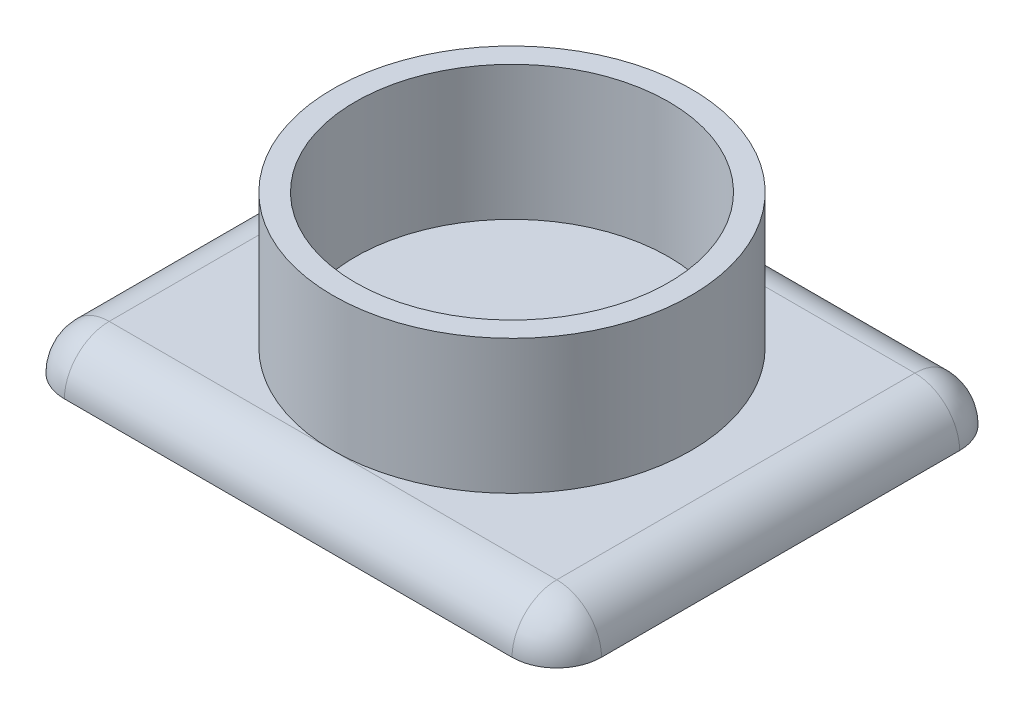
from build123d import *

# Parameters (mm, degrees)
SKETCH1_R           = 40
SKETCH1_R_2         = 35
BOSS_EXTRUDE1_DEPTH = 30
SKETCH2_W           = 120
SKETCH2_H           = 100
BOSS_EXTRUDE2_DEPTH = 10
FILLET4_R           = 10
FILLET5_R           = 10


with BuildPart() as part:
    # Sketch1 → Boss-Extrude1 (new body)
    with BuildSketch(Plane(origin=(0, 0, 0), x_dir=(1, 0, 0), z_dir=(0, 1, 0))):
        with Locations(Location((0, 0, 0), (0, 0, 270))):
            Circle(SKETCH1_R)
        with Locations(Location((0, 0, 0), (0, 0, 270))):
            Circle(SKETCH1_R_2, mode=Mode.SUBTRACT)
    extrude(amount=BOSS_EXTRUDE1_DEPTH)

    # Sketch2 → Boss-Extrude2 (add)
    with BuildSketch(Plane.XZ):
        Rectangle(SKETCH2_W, SKETCH2_H)
    extrude(amount=BOSS_EXTRUDE2_DEPTH)

    # Fillet4
    fillet4_edges = [part.edges().sort_by_distance(p)[0] for p in [
        (60, -5, -50),
        (60, -5, 50),
        (-60, -5, 50),
        (-60, -5, -50),
    ]]
    fillet(fillet4_edges, radius=FILLET4_R)

    # Fillet5
    fillet5_edges = [part.edges().sort_by_distance(p)[0] for p in [
        (57.071067812, 0, -47.071067812),
        (0, 0, -50),
        (-57.071067812, 0, -47.071067812),
        (-60, 0, 0),
        (-57.071067812, 0, 47.071067812),
        (0, 0, 50),
        (57.071067812, 0, 47.071067812),
        (60, 0, 0),
    ]]
    fillet(fillet5_edges, radius=FILLET5_R - 0.0001)  # a hair under: the kernel refuses the full size


solid = part.part
